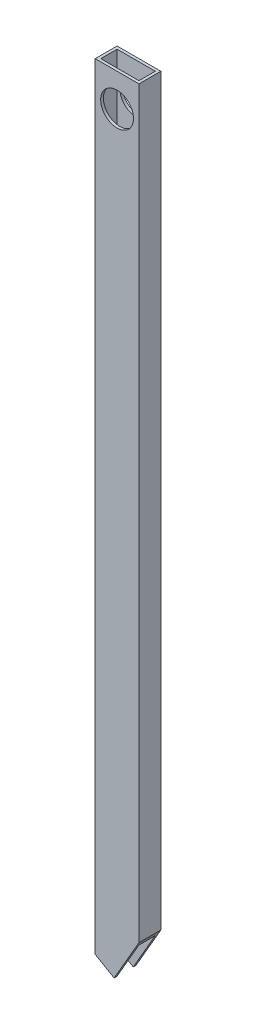
from build123d import *

# Parameters (mm, degrees)
SKETCH1_W           = 50.8
SKETCH1_H           = 25.4
SKETCH1_W_2         = 44.45
SKETCH1_H_2         = 19.05
BOSS_EXTRUDE1_DEPTH = 914.4
SKETCH2_R           = 19.05
CUT_EXTRUDE1_DEPTH  = 916.10528356


with BuildPart() as part:
    # Sketch1 → Boss-Extrude1 (new body)
    with BuildSketch(Plane(origin=(0, 0, 0), x_dir=(1, 0, 0), z_dir=(0, 1, 0))):
        Rectangle(SKETCH1_W, SKETCH1_H)
        Rectangle(SKETCH1_W_2, SKETCH1_H_2, mode=Mode.SUBTRACT)
    extrude(amount=BOSS_EXTRUDE1_DEPTH)

    # Sketch2 → Cut-Extrude1 (cut, through all)
    with BuildSketch(Plane.XY.offset(12.7)):
        Polygon((25.4, 49.888181024), (-3.402954744, 0), (25.4, 0), align=None)
        Polygon((-25.4, 12.7), (-25.4, 0), (-3.402954744, 0), align=None)
        with Locations((0, 876.3)):
            Circle(SKETCH2_R)
    extrude(amount=-CUT_EXTRUDE1_DEPTH, mode=Mode.SUBTRACT)


solid = part.part
